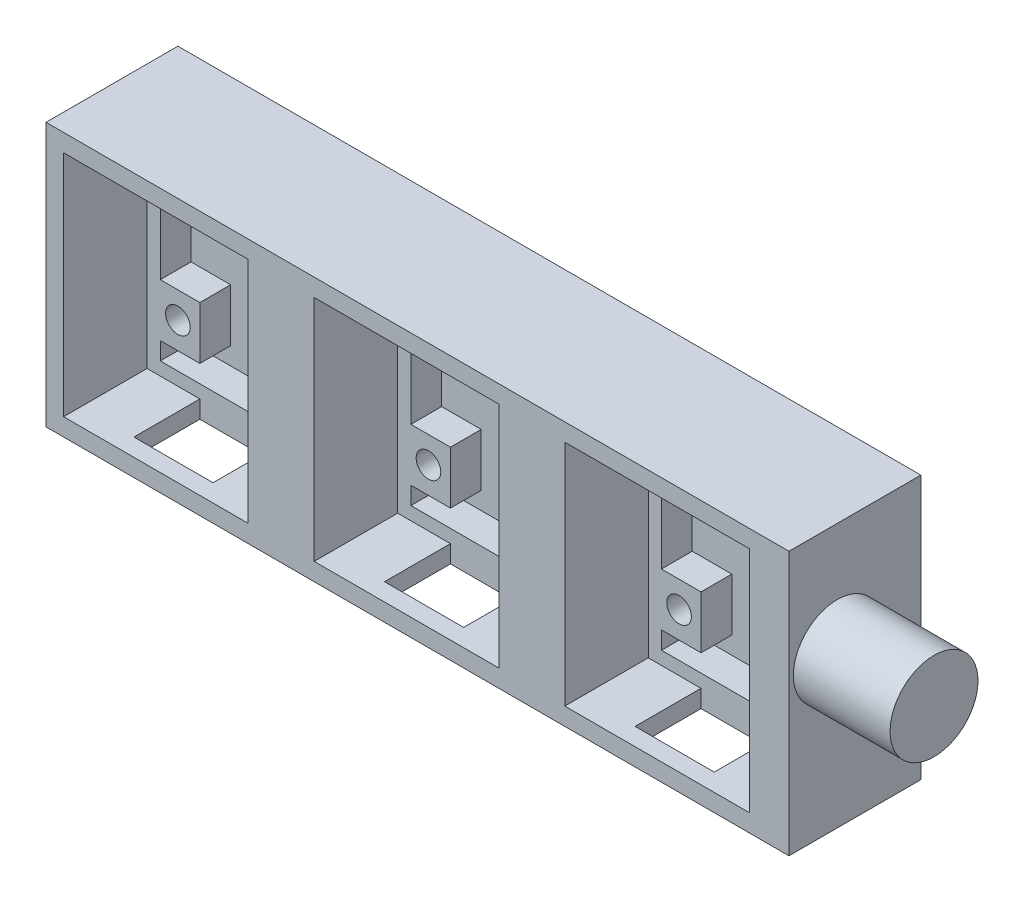
from build123d import *

# Parameters (mm, degrees)
SKETCH_1_W          = 84.5
SKETCH_1_H          = 30
EXTRUDE_1_DEPTH     = 15
SKETCH_2_W          = 21
SKETCH_2_H          = 26
CUT_EXTRUDE_1_DEPTH = 13
SKETCH_3_W          = 21
SKETCH_3_H          = 26
SKETCH_3_W_2        = 18
SKETCH_3_H_2        = 23
EXTRUDE_2_DEPTH     = 3.5
SKETCH_5_W          = 4.5
SKETCH_5_H          = 6
EXTRUDE_3_DEPTH     = 3.5
SKETCH_6_R          = 1.4
CUT_EXTRUDE_2_DEPTH = 94.726889515
SKETCH_7_W          = 9
SKETCH_7_H          = 7.5
CUT_EXTRUDE_3_DEPTH = 90.714734825
SKETCH_13_W         = 1.8
SKETCH_13_H         = 4.8
EXTRUDE_4_DEPTH     = 3
SKETCH_14_R         = 5
EXTRUDE_5_DEPTH     = 11
SKETCH_15_W         = 8
SKETCH_15_H         = 8
CUT_EXTRUDE_4_DEPTH = 10


with BuildPart() as part:
    # ｽｹｯﾁ1 → ﾎﾞｽ - 押し出し1 (new body)
    with BuildSketch(Plane.XY):
        with Locations((-41.65312059, 25.678571429)):
            Rectangle(SKETCH_1_W, SKETCH_1_H)
    extrude(amount=EXTRUDE_1_DEPTH)

    # ｽｹｯﾁ2 → ｶｯﾄ - 押し出し1 (cut)
    with BuildSketch(Plane.XY.offset(15)):
        with Locations((-71.40312059, 25.678571429)):
            Rectangle(SKETCH_2_W, SKETCH_2_H)
        with Locations((-42.90312059, 25.678571429)):
            Rectangle(SKETCH_2_W, SKETCH_2_H)
        with Locations((-14.40312059, 25.678571429)):
            Rectangle(SKETCH_2_W, SKETCH_2_H)
    extrude(amount=-CUT_EXTRUDE_1_DEPTH, mode=Mode.SUBTRACT)

    # ｽｹｯﾁ3 → ﾎﾞｽ - 押し出し2 (add)
    # profile 1 of 3: a face of its own
    with BuildSketch(Plane.XY.offset(2)):
        with Locations((-71.40312059, 25.678571429)):
            Rectangle(SKETCH_3_W, SKETCH_3_H)
        with Locations((-71.40312059, 25.678571429)):
            Rectangle(SKETCH_3_W_2, SKETCH_3_H_2, mode=Mode.SUBTRACT)
    # profile 2 of 3: a face of its own
    with BuildSketch(Plane.XY.offset(2)):
        with Locations((-42.90312059, 25.678571429)):
            Rectangle(SKETCH_3_W, SKETCH_3_H)
        with Locations((-42.90312059, 25.678571429)):
            Rectangle(SKETCH_3_W_2, SKETCH_3_H_2, mode=Mode.SUBTRACT)
    # profile 3 of 3: a face of its own
    with BuildSketch(Plane.XY.offset(2)):
        with Locations((-14.40312059, 25.678571429)):
            Rectangle(SKETCH_3_W, SKETCH_3_H)
        with Locations((-14.40312059, 25.678571429)):
            Rectangle(SKETCH_3_W_2, SKETCH_3_H_2, mode=Mode.SUBTRACT)
    extrude(amount=EXTRUDE_2_DEPTH)

    # ｽｹｯﾁ5 → ﾎﾞｽ - 押し出し3 (add)
    with BuildSketch(Plane.XY.offset(2)):
        with Locations((-64.65312059, 19.178571429)):
            Rectangle(SKETCH_5_W, SKETCH_5_H)
        with Locations((-78.15312059, 19.178571429)):
            Rectangle(SKETCH_5_W, SKETCH_5_H)
        with Locations((-49.65312059, 19.178571429)):
            Rectangle(SKETCH_5_W, SKETCH_5_H)
        with Locations((-36.15312059, 19.178571429)):
            Rectangle(SKETCH_5_W, SKETCH_5_H)
        with Locations((-21.15312059, 19.178571429)):
            Rectangle(SKETCH_5_W, SKETCH_5_H)
        with Locations((-7.65312059, 19.178571429)):
            Rectangle(SKETCH_5_W, SKETCH_5_H)
    extrude(amount=EXTRUDE_3_DEPTH)

    # ｽｹｯﾁ6 → ｶｯﾄ - 押し出し2 (cut, through all)
    with BuildSketch(Plane.XY.offset(5.5)):
        with Locations((-64.40312059, 19.178571429)):
            Circle(SKETCH_6_R)
        with Locations((-78.40312059, 19.178571429)):
            Circle(SKETCH_6_R)
        with Locations((-49.90312059, 19.178571429)):
            Circle(SKETCH_6_R)
        with Locations((-35.90312059, 19.178571429)):
            Circle(SKETCH_6_R)
        with Locations((-21.40312059, 19.178571429)):
            Circle(SKETCH_6_R)
        with Locations((-7.40312059, 19.178571429)):
            Circle(SKETCH_6_R)
    extrude(amount=-CUT_EXTRUDE_2_DEPTH, mode=Mode.SUBTRACT)

    # ｽｹｯﾁ7 → ｶｯﾄ - 押し出し3 (cut, through all)
    with BuildSketch(Plane(origin=(0, 12.678571429, 0), x_dir=(1, 0, 0), z_dir=(0, 1, 0))):
        with Locations((-71.40312059, -9.25)):
            Rectangle(SKETCH_7_W, SKETCH_7_H)
        with Locations((-42.90312059, -9.25)):
            Rectangle(SKETCH_7_W, SKETCH_7_H)
        with Locations((-14.40312059, -9.25)):
            Rectangle(SKETCH_7_W, SKETCH_7_H)
    extrude(amount=-CUT_EXTRUDE_3_DEPTH, mode=Mode.SUBTRACT)

    # ｽｹｯﾁ13 → ﾎﾞｽ - 押し出し4 (add)
    with BuildSketch(Plane.ZY.offset(83.90312059)):
        with Locations((0.9, 33.178571429)):
            Rectangle(SKETCH_13_W, SKETCH_13_H)
        with Locations((0.9, 18.178571429)):
            Rectangle(SKETCH_13_W, SKETCH_13_H)
    extrude(amount=EXTRUDE_4_DEPTH)

    # ｽｹｯﾁ14 → ﾎﾞｽ - 押し出し5 (add)
    with BuildSketch(Plane(origin=(0.59687941, 0, 0), x_dir=(0, 0, -1), z_dir=(1, 0, 0))):
        with Locations((-9.5, 28.178571429)):
            Circle(SKETCH_14_R)
    extrude(amount=EXTRUDE_5_DEPTH)

    # ｽｹｯﾁ15 → ｶｯﾄ - 押し出し4 (cut)
    with BuildSketch(Plane(origin=(0, 0, 0), x_dir=(-1, 0, 0), z_dir=(0, 0, -1))):
        with Locations((9.40312059, 25.678571429)):
            Rectangle(SKETCH_15_W, SKETCH_15_H)
    extrude(amount=-CUT_EXTRUDE_4_DEPTH, mode=Mode.SUBTRACT)


solid = part.part
